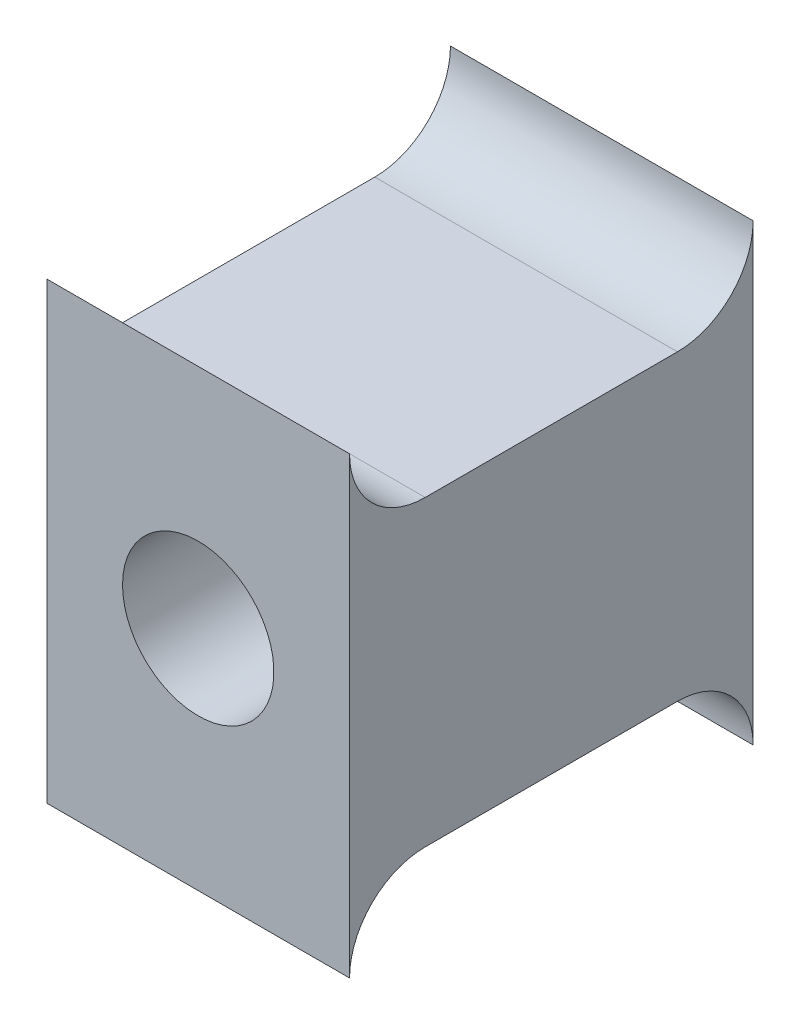
from build123d import *

# Parameters (mm, degrees)
SKETCH1_W           = 25.4
SKETCH1_H           = 25.4
SKETCH1_R           = 6.35
BOSS_EXTRUDE1_DEPTH = 16.93418
BOSS_EXTRUDE2_DEPTH = 25.4
FILLET1_R           = 6.35
CUT_EXTRUDE1_DEPTH  = 39.338661357


with BuildPart() as part:
    # Sketch1 → Boss-Extrude1 (new, symmetric)
    with BuildSketch(Plane.XY):
        Rectangle(SKETCH1_W, SKETCH1_H)
        Circle(SKETCH1_R, mode=Mode.SUBTRACT)
    extrude(amount=BOSS_EXTRUDE1_DEPTH, both=True)

    # Sketch3 → Boss-Extrude2 (add)
    with BuildSketch(Plane(origin=(12.7, 0, 0), x_dir=(0, 0, -1), z_dir=(1, 0, 0))):
        Polygon((-16.93418, -12.7), (-16.93418, 12.7), (-16.93418, 19.05), (-21.489310241, 19.05), (-21.489310241, -19.05), (-16.93418, -19.05), align=None)
        Polygon((16.93418, -12.7), (16.93418, 12.7), (16.93418, 19.05), (21.489310241, 19.05), (21.489310241, -19.05), (16.93418, -19.05), align=None)
    extrude(amount=-BOSS_EXTRUDE2_DEPTH)

    # Fillet1
    fillet1_edges = [part.edges().sort_by_distance(p)[0] for p in [
        (0, -12.7, -16.93418),
        (0, -12.7, 16.93418),
        (0, 12.7, 16.93418),
        (0, 12.7, -16.93418),
    ]]
    fillet(fillet1_edges, radius=FILLET1_R - 0.0001)  # a hair under: the kernel refuses the full size

    # Sketch3<2> → Cut-Extrude1 (cut, through all)
    with BuildSketch(Plane(origin=(12.7, 0, 0), x_dir=(0, 0, -1), z_dir=(1, 0, 0))):
        Polygon((-16.93418, -12.7), (-16.93418, 12.7), (-16.93418, 19.05), (-21.489310241, 19.05), (-21.489310241, -19.05), (-16.93418, -19.05), align=None)
        Polygon((16.93418, -12.7), (16.93418, 12.7), (16.93418, 19.05), (21.489310241, 19.05), (21.489310241, -19.05), (16.93418, -19.05), align=None)
    extrude(amount=-CUT_EXTRUDE1_DEPTH, mode=Mode.SUBTRACT)


solid = part.part
